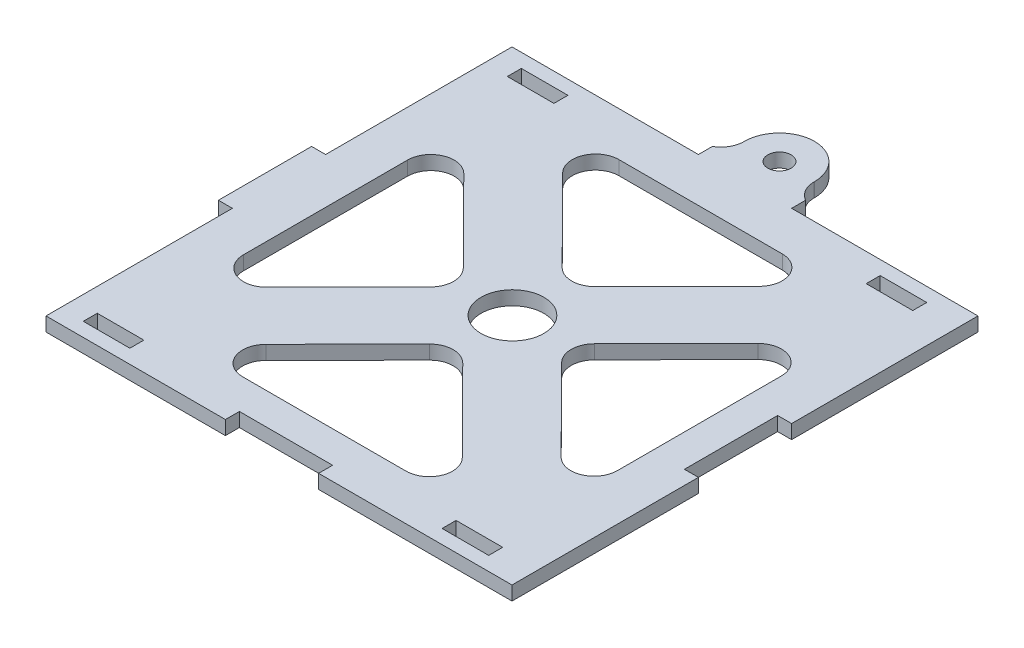
from build123d import *

# Parameters (mm, degrees)
SKETCH1_R           = 6.736700536
SKETCH1_W           = 10
SKETCH1_H           = 3
SKETCH1_R_2         = 2.5
BOSS_EXTRUDE1_DEPTH = 3
FILLET1_R           = 5
SKETCH5_W           = 20
SKETCH5_H           = 3
CUT_EXTRUDE1_DEPTH  = 3


with BuildPart() as part:
    # Sketch1 → Boss-Extrude1 (new body)
    with BuildSketch(Plane(origin=(0, 0, 0), x_dir=(1, 0, 0), z_dir=(0, 1, 0))):
        with BuildLine():
            Line((-49.938910977, -10.158402567), (-49.938910977, -50.158402567))
            Line((-49.938910977, -50.158402567), (50.061089023, -50.158402567))
            Line((50.061089023, -50.158402567), (50.061089023, -10.158402567))
            Line((50.061089023, -10.158402567), (47.061089023, -10.158402567))
            Line((47.061089023, -10.158402567), (47.061089023, 9.841597433))
            Line((47.061089023, 9.841597433), (50.061089023, 9.841597433))
            Line((50.061089023, 9.841597433), (50.061089023, 49.841597433))
            Line((50.061089023, 49.841597433), (10.061089023, 49.841597433))
            Line((10.061089023, 49.841597433), (10.061089023, 52.841597433))
            Line((10.061089023, 52.841597433), (7.561089023, 52.841597433))
            Line((7.561089023, 52.841597433), (7.561089023, 57.243104586))
            ThreePointArc((7.561089023, 57.243104586), (0.061089023, 64.743104586), (-7.438910977, 57.243104586))
            Line((-7.438910977, 57.243104586), (-7.438910977, 52.841597433))
            Line((-7.438910977, 52.841597433), (-9.938910977, 52.841597433))
            Line((-9.938910977, 52.841597433), (-9.938910977, 49.841597433))
            Line((-9.938910977, 49.841597433), (-49.938910977, 49.841597433))
            Line((-49.938910977, 49.841597433), (-49.938910977, 9.841597433))
            Line((-49.938910977, 9.841597433), (-52.938910977, 9.841597433))
            Line((-52.938910977, 9.841597433), (-52.938910977, -10.158402567))
            Line((-52.938910977, -10.158402567), (-49.938910977, -10.158402567))
        make_face()
        Polygon((-40.119028072, -29.730929333), (-40.119028072, 29.730929333), (-10.573569788, 0), align=None, mode=Mode.SUBTRACT)
        Polygon((-29.545458284, 40.370874503), (29.545458284, 40.370874503), (0, 10.63994517), align=None, mode=Mode.SUBTRACT)
        Polygon((40.119028072, 29.730929333), (40.119028072, -29.730929333), (10.573569788, 0), align=None, mode=Mode.SUBTRACT)
        Polygon((29.545458284, -40.370874503), (-29.545458284, -40.370874503), (0, -10.63994517), align=None, mode=Mode.SUBTRACT)
        with Locations(Location((0, 0, 0), (0, 0, 270))):
            Circle(SKETCH1_R, mode=Mode.SUBTRACT)
        with Locations((-39.938910977, -45.658402567)):
            Rectangle(SKETCH1_W, SKETCH1_H, mode=Mode.SUBTRACT)
        with Locations((37.061089023, -45.658402567)):
            Rectangle(SKETCH1_W, SKETCH1_H, mode=Mode.SUBTRACT)
        with Locations((-39.938910977, 45.341597433)):
            Rectangle(SKETCH1_W, SKETCH1_H, mode=Mode.SUBTRACT)
        with Locations(Location((0.061089023, 57.243104586, 0), (0, 0, 270))):
            Circle(SKETCH1_R_2, mode=Mode.SUBTRACT)
        with Locations((37.061089023, 45.341597433)):
            Rectangle(SKETCH1_W, SKETCH1_H, mode=Mode.SUBTRACT)
    extrude(amount=BOSS_EXTRUDE1_DEPTH)

    # Fillet1
    # the kernel refuses this fillet: 5 mm, written as the material it adds along each edge
    with BuildSketch(Plane(origin=(7.561089023, 0, -52.841597433), x_dir=(1, 0, 0), z_dir=(0, 1, 0))) as fillet1_piece_1:
        with BuildLine():
            CenterArc((5, 4.330127019), FILLET1_R, 180, 60)
            Line((0, 4.330127019), (-0.1, 4.330127019))
            Line((-0.1, 4.330127019), (-0.1, 0))
            Line((-0.1, 0), (0, -0.1))
            ThreePointArc((0, -0.1), (1.25, -0.1), (2.45, -0.08660254))
            Line((2.45, -0.08660254), (2.5, 0))
        make_face()
    extrude(amount=3)
    # the kernel refuses this fillet: 5 mm, written as the material it adds along each edge
    with BuildSketch(Plane(origin=(-7.438910977, 0, -52.841597433), x_dir=(-1, 0, 0), z_dir=(0, 1, 0))) as fillet1_2_piece_1:
        with BuildLine():
            CenterArc((5, -4.330127019), FILLET1_R, 120, 60)
            Line((0, -4.330127019), (-0.1, -4.330127019))
            Line((-0.1, -4.330127019), (-0.1, 0))
            Line((-0.1, 0), (0, 0.1))
            ThreePointArc((0, 0.1), (1.25, 0.1), (2.45, 0.08660254))
            Line((2.45, 0.08660254), (2.5, 0))
        make_face()
    extrude(amount=3)
    # the kernel refuses this fillet: 5 mm, written as the material it adds along each edge
    with BuildSketch(Plane(origin=(-10.573569788, 0, 0), x_dir=(-0.7048908504671988, 0, 0.7093157892840319), z_dir=(0, 1, 0))) as fillet1_3_piece_1:
        with BuildLine():
            CenterArc((FILLET1_R * 0.993761680081, -FILLET1_R), FILLET1_R, 90, 89.6414534)
            Line((-FILLET1_R * 0.00621873983502, -FILLET1_R * 0.993742222145), (-FILLET1_R * 0.0262183482333, -FILLET1_R * 0.993617066588))
            Line((-FILLET1_R * 0.0262183482333, -FILLET1_R * 0.993617066588), (-FILLET1_R * 0.0198752336016, FILLET1_R * 0.02))
            Line((-FILLET1_R * 0.0198752336016, FILLET1_R * 0.02), (FILLET1_R * 0.993761680081, FILLET1_R * 0.02))
            Line((FILLET1_R * 0.993761680081, FILLET1_R * 0.02), (FILLET1_R * 0.993761680081, 0))
        make_face()
    extrude(amount=3)
    # the kernel refuses this fillet: 5 mm, written as the material it adds along each edge
    with BuildSketch(Plane(origin=(-40.119028072, 0, 29.730929333), x_dir=(0, 0, -1), z_dir=(0, 1, 0))) as fillet1_4_piece_1:
        with BuildLine():
            CenterArc((FILLET1_R * 2.42493683689, -FILLET1_R), FILLET1_R, 90, 135.1792733)
            Line((FILLET1_R * 1.72004598642, -FILLET1_R * 1.70931578928), (FILLET1_R * 1.70594816941, -FILLET1_R * 1.72350210507))
            Line((FILLET1_R * 1.70594816941, -FILLET1_R * 1.72350210507), (-FILLET1_R * 0.0140978170093, -FILLET1_R * 0.0141863157857))
            Line((-FILLET1_R * 0.0140978170093, -FILLET1_R * 0.0141863157857), (0, FILLET1_R * 0.02))
            Line((0, FILLET1_R * 0.02), (FILLET1_R * 2.42493683689, FILLET1_R * 0.02))
            Line((FILLET1_R * 2.42493683689, FILLET1_R * 0.02), (FILLET1_R * 2.42493683689, 0))
        make_face()
    extrude(amount=3)
    # the kernel refuses this fillet: 5 mm, written as the material it adds along each edge
    with BuildSketch(Plane(origin=(-40.119028072, 0, -29.730929333), x_dir=(0, 0, 1), z_dir=(0, 1, 0))) as fillet1_5_piece_1:
        with BuildLine():
            CenterArc((FILLET1_R * 2.42493683689, FILLET1_R), FILLET1_R, 134.8207267, 135.1792733)
            Line((FILLET1_R * 1.72004598642, FILLET1_R * 1.70931578928), (FILLET1_R * 1.70594816941, FILLET1_R * 1.72350210507))
            Line((FILLET1_R * 1.70594816941, FILLET1_R * 1.72350210507), (-FILLET1_R * 0.0140978170093, FILLET1_R * 0.0141863157857))
            Line((-FILLET1_R * 0.0140978170093, FILLET1_R * 0.0141863157857), (0, -FILLET1_R * 0.02))
            Line((0, -FILLET1_R * 0.02), (FILLET1_R * 2.42493683689, -FILLET1_R * 0.02))
            Line((FILLET1_R * 2.42493683689, -FILLET1_R * 0.02), (FILLET1_R * 2.42493683689, 0))
        make_face()
    extrude(amount=3)
    # the kernel refuses this fillet: 5 mm, written as the material it adds along each edge
    with BuildSketch(Plane(origin=(-29.545458284, 0, -40.370874503), x_dir=(1, 0, 0), z_dir=(0, 1, 0))) as fillet1_6_piece_1:
        with BuildLine():
            CenterArc((FILLET1_R * 2.4035709852, -FILLET1_R), FILLET1_R, 90, 134.8207267)
            Line((FILLET1_R * 1.69425519592, -FILLET1_R * 1.70489085047), (FILLET1_R * 1.68006888013, -FILLET1_R * 1.71898866748))
            Line((FILLET1_R * 1.68006888013, -FILLET1_R * 1.71898866748), (-FILLET1_R * 0.0141863157857, -FILLET1_R * 0.0140978170093))
            Line((-FILLET1_R * 0.0141863157857, -FILLET1_R * 0.0140978170093), (0, FILLET1_R * 0.02))
            Line((0, FILLET1_R * 0.02), (FILLET1_R * 2.4035709852, FILLET1_R * 0.02))
            Line((FILLET1_R * 2.4035709852, FILLET1_R * 0.02), (FILLET1_R * 2.4035709852, 0))
        make_face()
    extrude(amount=3)
    # the kernel refuses this fillet: 5 mm, written as the material it adds along each edge
    with BuildSketch(Plane(origin=(29.545458284, 0, -40.370874503), x_dir=(-0.7048908504671981, 0, 0.7093157892840325), z_dir=(0, 1, 0))) as fillet1_7_piece_1:
        with BuildLine():
            CenterArc((FILLET1_R * 2.4035709852, -FILLET1_R), FILLET1_R, 90, 134.8207267)
            Line((FILLET1_R * 1.69425519592, -FILLET1_R * 1.70489085047), (FILLET1_R * 1.68006888013, -FILLET1_R * 1.71898866748))
            Line((FILLET1_R * 1.68006888013, -FILLET1_R * 1.71898866748), (-FILLET1_R * 0.0141863157857, -FILLET1_R * 0.0140978170093))
            Line((-FILLET1_R * 0.0141863157857, -FILLET1_R * 0.0140978170093), (0, FILLET1_R * 0.02))
            Line((0, FILLET1_R * 0.02), (FILLET1_R * 2.4035709852, FILLET1_R * 0.02))
            Line((FILLET1_R * 2.4035709852, FILLET1_R * 0.02), (FILLET1_R * 2.4035709852, 0))
        make_face()
    extrude(amount=3)
    # the kernel refuses this fillet: 5 mm, written as the material it adds along each edge
    with BuildSketch(Plane(origin=(0, 0, -10.63994517), x_dir=(0.7048908504671987, 0, -0.7093157892840322), z_dir=(0, 1, 0))) as fillet1_8_piece_1:
        with BuildLine():
            CenterArc((FILLET1_R * 1.00627748085, FILLET1_R), FILLET1_R, 179.6414534, 90.3585466)
            Line((FILLET1_R * 0.00629706093592, FILLET1_R * 1.00625777786), (-FILLET1_R * 0.0137025474624, FILLET1_R * 1.00638293341))
            Line((-FILLET1_R * 0.0137025474624, FILLET1_R * 1.00638293341), (-FILLET1_R * 0.020125549617, -FILLET1_R * 0.02))
            Line((-FILLET1_R * 0.020125549617, -FILLET1_R * 0.02), (FILLET1_R * 1.00627748085, -FILLET1_R * 0.02))
            Line((FILLET1_R * 1.00627748085, -FILLET1_R * 0.02), (FILLET1_R * 1.00627748085, 0))
        make_face()
    extrude(amount=3)
    # the kernel refuses this fillet: 5 mm, written as the material it adds along each edge
    with BuildSketch(Plane(origin=(40.119028072, 0, -29.730929333), x_dir=(0, 0, 1), z_dir=(0, 1, 0))) as fillet1_9_piece_1:
        with BuildLine():
            CenterArc((FILLET1_R * 2.42493683689, -FILLET1_R), FILLET1_R, 90, 135.1792733)
            Line((FILLET1_R * 1.72004598642, -FILLET1_R * 1.70931578928), (FILLET1_R * 1.70594816941, -FILLET1_R * 1.72350210507))
            Line((FILLET1_R * 1.70594816941, -FILLET1_R * 1.72350210507), (-FILLET1_R * 0.0140978170093, -FILLET1_R * 0.0141863157857))
            Line((-FILLET1_R * 0.0140978170093, -FILLET1_R * 0.0141863157857), (0, FILLET1_R * 0.02))
            Line((0, FILLET1_R * 0.02), (FILLET1_R * 2.42493683689, FILLET1_R * 0.02))
            Line((FILLET1_R * 2.42493683689, FILLET1_R * 0.02), (FILLET1_R * 2.42493683689, 0))
        make_face()
    extrude(amount=3)
    # the kernel refuses this fillet: 5 mm, written as the material it adds along each edge
    with BuildSketch(Plane(origin=(40.119028072, 0, 29.730929333), x_dir=(-0.7048908504671988, 0, -0.7093157892840319), z_dir=(0, 1, 0))) as fillet1_10_piece_1:
        with BuildLine():
            CenterArc((FILLET1_R * 2.42493683689, -FILLET1_R), FILLET1_R, 90, 135.1792733)
            Line((FILLET1_R * 1.72004598642, -FILLET1_R * 1.70931578928), (FILLET1_R * 1.70594816941, -FILLET1_R * 1.72350210507))
            Line((FILLET1_R * 1.70594816941, -FILLET1_R * 1.72350210507), (-FILLET1_R * 0.0140978170093, -FILLET1_R * 0.0141863157857))
            Line((-FILLET1_R * 0.0140978170093, -FILLET1_R * 0.0141863157857), (0, FILLET1_R * 0.02))
            Line((0, FILLET1_R * 0.02), (FILLET1_R * 2.42493683689, FILLET1_R * 0.02))
            Line((FILLET1_R * 2.42493683689, FILLET1_R * 0.02), (FILLET1_R * 2.42493683689, 0))
        make_face()
    extrude(amount=3)
    # the kernel refuses this fillet: 5 mm, written as the material it adds along each edge
    with BuildSketch(Plane(origin=(10.573569788, 0, 0), x_dir=(0.7048908504671986, 0, 0.7093157892840322), z_dir=(0, 1, 0))) as fillet1_11_piece_1:
        with BuildLine():
            CenterArc((FILLET1_R * 0.993761680081, FILLET1_R), FILLET1_R, 180.3585466, 89.6414534)
            Line((-FILLET1_R * 0.00621873983502, FILLET1_R * 0.993742222145), (-FILLET1_R * 0.0262183482333, FILLET1_R * 0.993617066588))
            Line((-FILLET1_R * 0.0262183482333, FILLET1_R * 0.993617066588), (-FILLET1_R * 0.0198752336016, -FILLET1_R * 0.02))
            Line((-FILLET1_R * 0.0198752336016, -FILLET1_R * 0.02), (FILLET1_R * 0.993761680081, -FILLET1_R * 0.02))
            Line((FILLET1_R * 0.993761680081, -FILLET1_R * 0.02), (FILLET1_R * 0.993761680081, 0))
        make_face()
    extrude(amount=3)
    # the kernel refuses this fillet: 5 mm, written as the material it adds along each edge
    with BuildSketch(Plane(origin=(0, 0, 10.63994517), x_dir=(0.7048908504671988, 0, 0.709315789284032), z_dir=(0, 1, 0))) as fillet1_12_piece_1:
        with BuildLine():
            CenterArc((FILLET1_R * 1.00627748085, -FILLET1_R), FILLET1_R, 90, 90.3585466)
            Line((FILLET1_R * 0.00629706093592, -FILLET1_R * 1.00625777786), (-FILLET1_R * 0.0137025474624, -FILLET1_R * 1.00638293341))
            Line((-FILLET1_R * 0.0137025474624, -FILLET1_R * 1.00638293341), (-FILLET1_R * 0.020125549617, FILLET1_R * 0.02))
            Line((-FILLET1_R * 0.020125549617, FILLET1_R * 0.02), (FILLET1_R * 1.00627748085, FILLET1_R * 0.02))
            Line((FILLET1_R * 1.00627748085, FILLET1_R * 0.02), (FILLET1_R * 1.00627748085, 0))
        make_face()
    extrude(amount=3)
    # the kernel refuses this fillet: 5 mm, written as the material it adds along each edge
    with BuildSketch(Plane(origin=(29.545458284, 0, 40.370874503), x_dir=(-1, 0, 0), z_dir=(0, 1, 0))) as fillet1_13_piece_1:
        with BuildLine():
            CenterArc((FILLET1_R * 2.4035709852, -FILLET1_R), FILLET1_R, 90, 134.8207267)
            Line((FILLET1_R * 1.69425519592, -FILLET1_R * 1.70489085047), (FILLET1_R * 1.68006888013, -FILLET1_R * 1.71898866748))
            Line((FILLET1_R * 1.68006888013, -FILLET1_R * 1.71898866748), (-FILLET1_R * 0.0141863157857, -FILLET1_R * 0.0140978170093))
            Line((-FILLET1_R * 0.0141863157857, -FILLET1_R * 0.0140978170093), (0, FILLET1_R * 0.02))
            Line((0, FILLET1_R * 0.02), (FILLET1_R * 2.4035709852, FILLET1_R * 0.02))
            Line((FILLET1_R * 2.4035709852, FILLET1_R * 0.02), (FILLET1_R * 2.4035709852, 0))
        make_face()
    extrude(amount=3)
    # the kernel refuses this fillet: 5 mm, written as the material it adds along each edge
    with BuildSketch(Plane(origin=(-29.545458284, 0, 40.370874503), x_dir=(1, 0, 0), z_dir=(0, 1, 0))) as fillet1_14_piece_1:
        with BuildLine():
            CenterArc((FILLET1_R * 2.4035709852, FILLET1_R), FILLET1_R, 135.1792733, 134.8207267)
            Line((FILLET1_R * 1.69425519592, FILLET1_R * 1.70489085047), (FILLET1_R * 1.68006888013, FILLET1_R * 1.71898866748))
            Line((FILLET1_R * 1.68006888013, FILLET1_R * 1.71898866748), (-FILLET1_R * 0.0141863157857, FILLET1_R * 0.0140978170093))
            Line((-FILLET1_R * 0.0141863157857, FILLET1_R * 0.0140978170093), (0, -FILLET1_R * 0.02))
            Line((0, -FILLET1_R * 0.02), (FILLET1_R * 2.4035709852, -FILLET1_R * 0.02))
            Line((FILLET1_R * 2.4035709852, -FILLET1_R * 0.02), (FILLET1_R * 2.4035709852, 0))
        make_face()
    extrude(amount=3)

    # Sketch5 → Cut-Extrude1 (cut)
    with BuildSketch(Plane.XY.offset(50.158402567)):
        with Locations((-1.438910977, 1.5)):
            Rectangle(SKETCH5_W, SKETCH5_H)
    extrude(amount=-CUT_EXTRUDE1_DEPTH, mode=Mode.SUBTRACT)


solid = part.part
